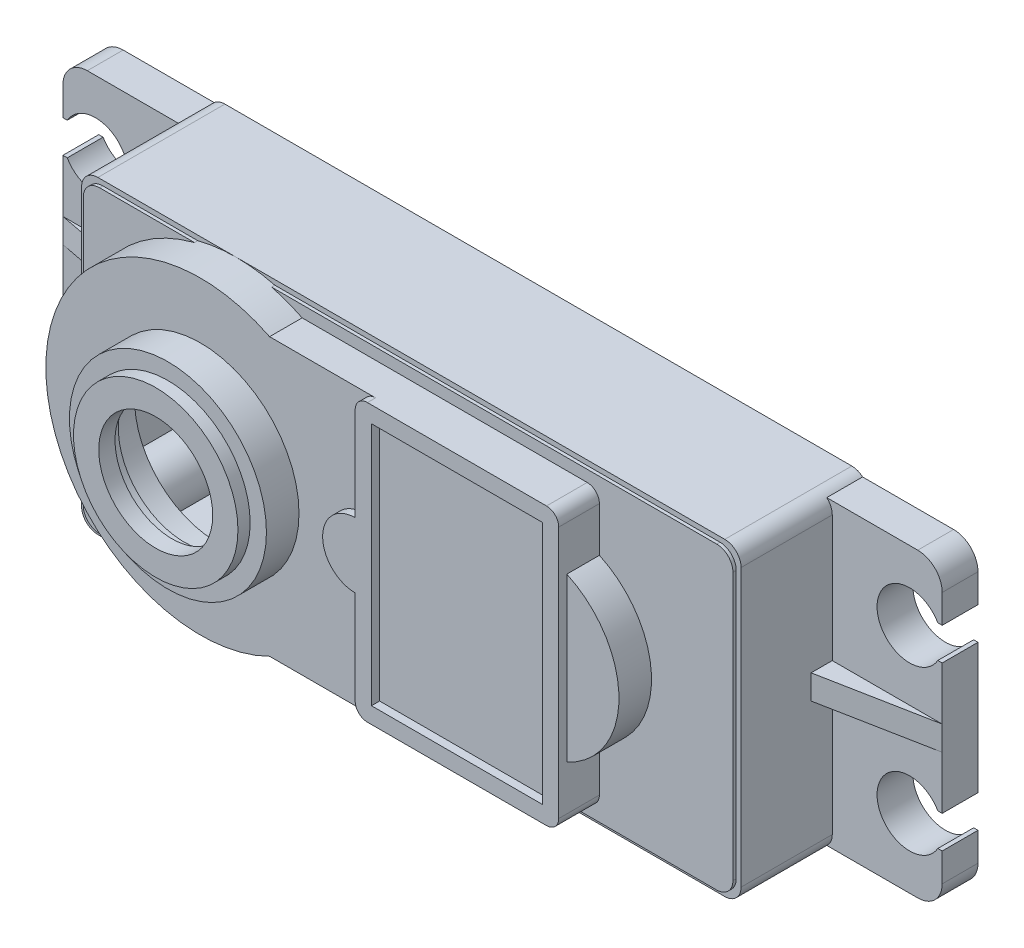
from build123d import *

# Parameters (mm, degrees)
CROQUIS1_R              = 3.5
CROQUIS1_R_2            = 0.8
SALIENTE_EXTRUIR1_DEPTH = 7.8
SALIENTE_EXTRUIR2_DEPTH = 0.2
CROQUIS2_5_R            = 3.5
SALIENTE_EXTRUIR4_DEPTH = 2.2
CROQUIS5_R              = 6.05
CROQUIS5_R_2            = 5.05
SALIENTE_EXTRUIR5_DEPTH = 12
CROQUIS5_3_R            = 5.05
CROQUIS5_3_R_2          = 3.5
SALIENTE_EXTRUIR6_DEPTH = 12.75
VACIADO6_DEPTH          = 6.8
VACIADO6_START          = 6.8
VACIADO6_2_DEPTH        = 2.2
VACIADO6_START_2        = 9
VACIADO6_3_OUTLINE_R    = 5.05
VACIADO6_3_DEPTH        = 2
VACIADO6_START_3        = 11
VACIADO6_4_OUTLINE_R    = 4.05
VACIADO6_4_DEPTH        = 0.75
VACIADO6_5_DEPTH        = 0.2
CROQUIS1_7_R            = 3.5
CORTAR_EXTRUIR3_DEPTH   = 19
SALIENTE_EXTRUIR7_DEPTH = 2.2
CORTAR_EXTRUIR7_DEPTH   = 2.2
NERVIO3_REACH           = 42.962
CROQUIS13_WALL_W        = 90.79779042
CROQUIS13_WALL_H        = 1.5
NERVIO6_REACH           = 42.962
CROQUIS14_WALL_W        = 90.79779042
CROQUIS14_WALL_H        = 1.5
CROQUIS15_W             = 10.5
CROQUIS15_H             = 15
SALIENTE_EXTRUIR8_DEPTH = 0.5
REDONDEO1_R             = 0.75


# Read off the part's stored shape, not the designer's step: Vaciado6
with BuildPart() as part:
    # Croquis1 → Saliente-Extruir1 (new body)
    with BuildSketch(Plane.XY):
        with BuildLine():
            Line((-9.5, 8.5), (-9.5, -8.5))
            ThreePointArc((-9.5, -8.5), (-9.207106781, -9.207106781), (-8.5, -9.5))
            Line((-8.5, -9.5), (30, -9.5))
            ThreePointArc((30, -9.5), (30.707106781, -9.207106781), (31, -8.5))
            Line((31, -8.5), (31, 8.5))
            ThreePointArc((31, 8.5), (30.707106781, 9.207106781), (30, 9.5))
            Line((30, 9.5), (-8.5, 9.5))
            ThreePointArc((-8.5, 9.5), (-9.207106781, 9.207106781), (-9.5, 8.5))
        make_face()
        Circle(CROQUIS1_R, mode=Mode.SUBTRACT)
        with Locations((29.4, -7.9)):
            Circle(CROQUIS1_R_2, mode=Mode.SUBTRACT)
        with Locations((-7.9, -7.9)):
            Circle(CROQUIS1_R_2, mode=Mode.SUBTRACT)
        with Locations((-7.9, 7.9)):
            Circle(CROQUIS1_R_2, mode=Mode.SUBTRACT)
        with Locations((29.4, 7.9)):
            Circle(CROQUIS1_R_2, mode=Mode.SUBTRACT)
    extrude(amount=SALIENTE_EXTRUIR1_DEPTH)

    # Croquis2 → Saliente-Extruir2 (add)
    with BuildSketch(Plane.XY.offset(7.8)):
        with BuildLine():
            Line((2.368543856, -9.2), (29.7, -9.2))
            ThreePointArc((29.7, -9.2), (30.407106781, -8.907106781), (30.7, -8.2))
            Line((30.7, -8.2), (30.7, 8.2))
            ThreePointArc((30.7, 8.2), (30.407106781, 8.907106781), (29.7, 9.2))
            Line((29.7, 9.2), (2.368543856, 9.2))
            ThreePointArc((2.368543856, 9.2), (3.324069835, 8.899469632), (4.242640687, 8.5))
            Line((4.242640687, 8.5), (22.5, 8.5))
            Line((22.5, 8.5), (22.5, 5))
            ThreePointArc((22.5, 5), (25.7, 0), (22.5, -5))
            Line((22.5, -5), (22.5, -8.5))
            Line((22.5, -8.5), (4.242640687, -8.5))
            ThreePointArc((4.242640687, -8.5), (3.324069835, -8.899469632), (2.368543856, -9.2))
        make_face()
        with BuildLine():
            Line((-8.2, -9.2), (-2.368543856, -9.2))
            ThreePointArc((-2.368543856, -9.2), (-6.717514421, -6.717514421), (-9.2, -2.368543856))
            Line((-9.2, -2.368543856), (-9.2, -8.2))
            ThreePointArc((-9.2, -8.2), (-8.907106781, -8.907106781), (-8.2, -9.2))
        make_face()
        with BuildLine():
            Line((-9.2, 8.2), (-9.2, 2.368543856))
            ThreePointArc((-9.2, 2.368543856), (-6.717514421, 6.717514421), (-2.368543856, 9.2))
            Line((-2.368543856, 9.2), (-8.2, 9.2))
            ThreePointArc((-8.2, 9.2), (-8.907106781, 8.907106781), (-9.2, 8.2))
        make_face()
    extrude(amount=SALIENTE_EXTRUIR2_DEPTH)

    # Croquis2<5> → Saliente-Extruir4 (add)
    # profile 1 of 6: a face of its own
    with BuildSketch(Plane.XY.offset(7.8)):
        with BuildLine():
            ThreePointArc((9.5, 0), (8.079451916, -4.997244915), (4.242640687, -8.5))
            Line((4.242640687, -8.5), (22.5, -8.5))
            Line((22.5, -8.5), (22.5, -5))
            Line((22.5, -5), (22.5, 5))
            Line((22.5, 5), (22.5, 8.5))
            Line((22.5, 8.5), (4.242640687, 8.5))
            ThreePointArc((4.242640687, 8.5), (8.079451916, 4.997244915), (9.5, 0))
        make_face()
    # profile 2 of 6: a face of its own
    with BuildSketch(Plane.XY.offset(7.8)):
        with BuildLine():
            Line((-2.368543856, -9.2), (2.368543856, -9.2))
            ThreePointArc((2.368543856, -9.2), (3.324069835, -8.899469632), (4.242640687, -8.5))
            ThreePointArc((4.242640687, -8.5), (8.079451916, -4.997244915), (9.5, 0))
            ThreePointArc((9.5, 0), (8.079451916, 4.997244915), (4.242640687, 8.5))
            ThreePointArc((4.242640687, 8.5), (3.324069835, 8.899469632), (2.368543856, 9.2))
            Line((2.368543856, 9.2), (-2.368543856, 9.2))
            ThreePointArc((-2.368543856, 9.2), (-6.717514421, 6.717514421), (-9.2, 2.368543856))
            Line((-9.2, 2.368543856), (-9.2, -2.368543856))
            ThreePointArc((-9.2, -2.368543856), (-6.717514421, -6.717514421), (-2.368543856, -9.2))
        make_face()
        Circle(CROQUIS2_5_R, mode=Mode.SUBTRACT)
    # profile 3 of 6: a face of its own
    with BuildSketch(Plane.XY.offset(7.8)):
        with BuildLine():
            Line((22.5, 5), (22.5, -5))
            ThreePointArc((22.5, -5), (25.7, 0), (22.5, 5))
        make_face()
    # profile 4 of 6: a face of its own
    with BuildSketch(Plane.XY.offset(7.8)):
        with BuildLine():
            ThreePointArc((-2.368543856, -9.2), (0, -9.5), (2.368543856, -9.2))
            Line((2.368543856, -9.2), (-2.368543856, -9.2))
        make_face()
    # profile 5 of 6: a face of its own
    with BuildSketch(Plane.XY.offset(7.8)):
        with BuildLine():
            ThreePointArc((-9.2, 2.368543856), (-9.5, 0), (-9.2, -2.368543856))
            Line((-9.2, -2.368543856), (-9.2, 2.368543856))
        make_face()
    # profile 6 of 6: a face of its own
    with BuildSketch(Plane.XY.offset(7.8)):
        with BuildLine():
            Line((-2.368543856, 9.2), (2.368543856, 9.2))
            ThreePointArc((2.368543856, 9.2), (0, 9.5), (-2.368543856, 9.2))
        make_face()
    extrude(amount=SALIENTE_EXTRUIR4_DEPTH)

    # Croquis5 → Saliente-Extruir5 (add)
    with BuildSketch(Plane.XY):
        Circle(CROQUIS5_R)
        Circle(CROQUIS5_R_2, mode=Mode.SUBTRACT)
    extrude(amount=SALIENTE_EXTRUIR5_DEPTH)

    # Croquis5<3> → Saliente-Extruir6 (add)
    # profile 1 of 2: a face of its own
    with BuildSketch(Plane.XY):
        Circle(CROQUIS5_3_R)
        Circle(CROQUIS5_3_R_2, mode=Mode.SUBTRACT)
    # profile 2 of 2: a face of its own
    with BuildSketch(Plane.XY):
        Circle(CROQUIS5_3_R_2)
    extrude(amount=SALIENTE_EXTRUIR6_DEPTH)

    # Vaciado6 outline → Vaciado6 (cut)
    with BuildSketch(Plane.XY):
        with BuildLine():
            ThreePointArc((-8.5, -6.202943725), (-6.627207794, -6.627207794), (-6.202943725, -8.5))
            Line((-6.202943725, -8.5), (27.702943725, -8.5))
            ThreePointArc((27.702943725, -8.5), (28.127207794, -6.627207794), (30, -6.202943725))
            Line((30, -6.202943725), (30, 6.202943725))
            ThreePointArc((30, 6.202943725), (28.127207794, 6.627207794), (27.702943725, 8.5))
            Line((27.702943725, 8.5), (-6.202943725, 8.5))
            ThreePointArc((-6.202943725, 8.5), (-6.627207794, 6.627207794), (-8.5, 6.202943725))
            Line((-8.5, 6.202943725), (-8.5, -6.202943725))
        make_face()
    extrude(amount=VACIADO6_DEPTH, mode=Mode.SUBTRACT)

    # Vaciado6 2 outline → Vaciado6 2 (cut)
    with BuildSketch(Plane.XY.offset(VACIADO6_START)):
        with BuildLine():
            Line((4, -7.5), (21.5, -7.5))
            Line((21.5, -7.5), (21.5, -4.312771731))
            ThreePointArc((21.5, -4.312771731), (24.7, 0), (21.5, 4.312771731))
            Line((21.5, 4.312771731), (21.5, 7.5))
            Line((21.5, 7.5), (4, 7.5))
            ThreePointArc((4, 7.5), (-8.5, 0), (4, -7.5))
        make_face()
    extrude(amount=VACIADO6_2_DEPTH, mode=Mode.SUBTRACT)

    # Vaciado6 3 outline → Vaciado6 3 (cut)
    with BuildSketch(Plane.XY.offset(VACIADO6_START_2)):
        Circle(VACIADO6_3_OUTLINE_R)
    extrude(amount=VACIADO6_3_DEPTH, mode=Mode.SUBTRACT)

    # Vaciado6 4 outline → Vaciado6 4 (cut)
    with BuildSketch(Plane.XY.offset(VACIADO6_START_3)):
        Circle(VACIADO6_4_OUTLINE_R)
    extrude(amount=VACIADO6_4_DEPTH, mode=Mode.SUBTRACT)

    # Vaciado6 5 outline → Vaciado6 5 (cut)
    with BuildSketch(Plane.XY.offset(VACIADO6_START)):
        with BuildLine():
            Line((-8.2, -2.238302929), (-8.2, -6.125176065))
            ThreePointArc((-8.2, -6.125176065), (-6.627207794, -6.627207794), (-6.125176065, -8.2))
            Line((-6.125176065, -8.2), (-2.238302929, -8.2))
            ThreePointArc((-2.238302929, -8.2), (-6.01040764, -6.01040764), (-8.2, -2.238302929))
        make_face()
        with BuildLine():
            Line((-8.2, 6.125176065), (-8.2, 2.238302929))
            ThreePointArc((-8.2, 2.238302929), (-6.01040764, 6.01040764), (-2.238302929, 8.2))
            Line((-2.238302929, 8.2), (-6.125176065, 8.2))
            ThreePointArc((-6.125176065, 8.2), (-6.627207794, 6.627207794), (-8.2, 6.125176065))
        make_face()
        with BuildLine():
            ThreePointArc((4, -7.5), (3.138726789, -7.899265418), (2.238302929, -8.2))
            Line((2.238302929, -8.2), (27.625176065, -8.2))
            ThreePointArc((27.625176065, -8.2), (28.127207794, -6.627207794), (29.7, -6.125176065))
            Line((29.7, -6.125176065), (29.7, 6.125176065))
            ThreePointArc((29.7, 6.125176065), (28.127207794, 6.627207794), (27.625176065, 8.2))
            Line((27.625176065, 8.2), (2.238302929, 8.2))
            ThreePointArc((2.238302929, 8.2), (3.138726789, 7.899265418), (4, 7.5))
            Line((4, 7.5), (21.5, 7.5))
            Line((21.5, 7.5), (21.5, 4.312771731))
            ThreePointArc((21.5, 4.312771731), (24.7, 0), (21.5, -4.312771731))
            Line((21.5, -4.312771731), (21.5, -7.5))
            Line((21.5, -7.5), (4, -7.5))
        make_face()
    extrude(amount=VACIADO6_5_DEPTH, mode=Mode.SUBTRACT)

    # Croquis1<7> → Cortar-Extruir3 (cut)
    with BuildSketch(Plane.XY):
        Circle(CROQUIS1_7_R)
    extrude(amount=CORTAR_EXTRUIR3_DEPTH, mode=Mode.SUBTRACT)

    # Croquis8 → Saliente-Extruir7 (add)
    with BuildSketch(Plane.XY):
        with BuildLine():
            Line((-16.25, 7.75), (-16.25, -7.75))
            ThreePointArc((-16.25, -7.75), (-15.810660172, -8.810660172), (-14.75, -9.25))
            Line((-14.75, -9.25), (-9.161437828, -9.25))
            Line((-9.161437828, -9.25), (-9.161437828, 9.25))
            Line((-9.161437828, 9.25), (-14.75, 9.25))
            ThreePointArc((-14.75, 9.25), (-15.810660172, 8.810660172), (-16.25, 7.75))
        make_face()
        with BuildLine():
            Line((30.661437828, 9.25), (30.661437828, -9.25))
            Line((30.661437828, -9.25), (36.25, -9.25))
            ThreePointArc((36.25, -9.25), (37.310660172, -8.810660172), (37.75, -7.75))
            Line((37.75, -7.75), (37.75, 7.75))
            ThreePointArc((37.75, 7.75), (37.310660172, 8.810660172), (36.25, 9.25))
            Line((36.25, 9.25), (30.661437828, 9.25))
        make_face()
    extrude(amount=SALIENTE_EXTRUIR7_DEPTH)

    # Croquis9 → Cortar-Extruir7 (cut)
    with BuildSketch(Plane.XY):
        with BuildLine():
            Line((-16.25, 4), (-15.982050808, 4))
            ThreePointArc((-15.982050808, 4), (-12.25, 5), (-15.982050808, 6))
            Line((-15.982050808, 6), (-16.25, 6))
            Line((-16.25, 6), (-16.25, 4))
        make_face()
        with BuildLine():
            Line((-16.25, -6), (-15.982050808, -6))
            ThreePointArc((-15.982050808, -6), (-12.25, -5), (-15.982050808, -4))
            Line((-15.982050808, -4), (-16.25, -4))
            Line((-16.25, -4), (-16.25, -6))
        make_face()
        with BuildLine():
            ThreePointArc((37.482050808, -6), (33.75, -5), (37.482050808, -4))
            Line((37.482050808, -4), (37.75, -4))
            Line((37.75, -4), (37.75, -6))
            Line((37.75, -6), (37.482050808, -6))
        make_face()
        with BuildLine():
            ThreePointArc((37.482050808, 4), (33.75, 5), (37.482050808, 6))
            Line((37.482050808, 6), (37.75, 6))
            Line((37.75, 6), (37.75, 4))
            Line((37.75, 4), (37.482050808, 4))
        make_face()
    extrude(amount=CORTAR_EXTRUIR7_DEPTH, mode=Mode.SUBTRACT)

    # Croquis13 wall → Nervio3 (add, up to next)
    with BuildSketch(Plane(origin=(-12.875, 0, 2.85), x_dir=(-0.981954528773, 0, -0.189117168504), z_dir=(-0.189117168504, 0, 0.981954528773)), mode=Mode.PRIVATE) as nervio3_sk1:
        Rectangle(CROQUIS13_WALL_W, CROQUIS13_WALL_H)
    nervio3_tool1 = extrude(nervio3_sk1.sketch, amount=-NERVIO3_REACH, mode=Mode.PRIVATE) - part.part
    add(nervio3_tool1.solids().sort_by_distance((-12.875, 0, 2.85))[0])

    # Croquis14 wall → Nervio6 (add, up to next)
    with BuildSketch(Plane(origin=(34.375, 0, 2.85), x_dir=(0.981954528773, 0, -0.189117168504), z_dir=(-0.189117168504, 0, -0.981954528773)), mode=Mode.PRIVATE) as nervio6_sk1:
        Rectangle(CROQUIS14_WALL_W, CROQUIS14_WALL_H)
    nervio6_tool1 = extrude(nervio6_sk1.sketch, amount=NERVIO6_REACH, mode=Mode.PRIVATE) - part.part
    add(nervio6_tool1.solids().sort_by_distance((34.375, 0, 2.85))[0])

    # Croquis15 → Saliente-Extruir8 (add)
    with BuildSketch(Plane.XY.offset(10)):
        with BuildLine():
            Line((22.5, 8.5), (10.75, 8.5))
            ThreePointArc((10.75, 8.5), (10.219669914, 8.280330086), (10, 7.75))
            Line((10, 7.75), (10, 2))
            ThreePointArc((10, 2), (8, 0), (10, -2))
            Line((10, -2), (10, -7.75))
            ThreePointArc((10, -7.75), (10.219669914, -8.280330086), (10.75, -8.5))
            Line((10.75, -8.5), (22.5, -8.5))
            Line((22.5, -8.5), (22.5, 8.5))
        make_face()
        with Locations((16.25, 0)):
            Rectangle(CROQUIS15_W, CROQUIS15_H, mode=Mode.SUBTRACT)
    extrude(amount=SALIENTE_EXTRUIR8_DEPTH)

    # Redondeo1
    redondeo1_edges = [part.edges().sort_by_distance(p)[0] for p in [
        (22.5, 8.5, 9.25),
        (22.5, -8.5, 9.25),
    ]]
    fillet(redondeo1_edges, radius=REDONDEO1_R)


solid = part.part
